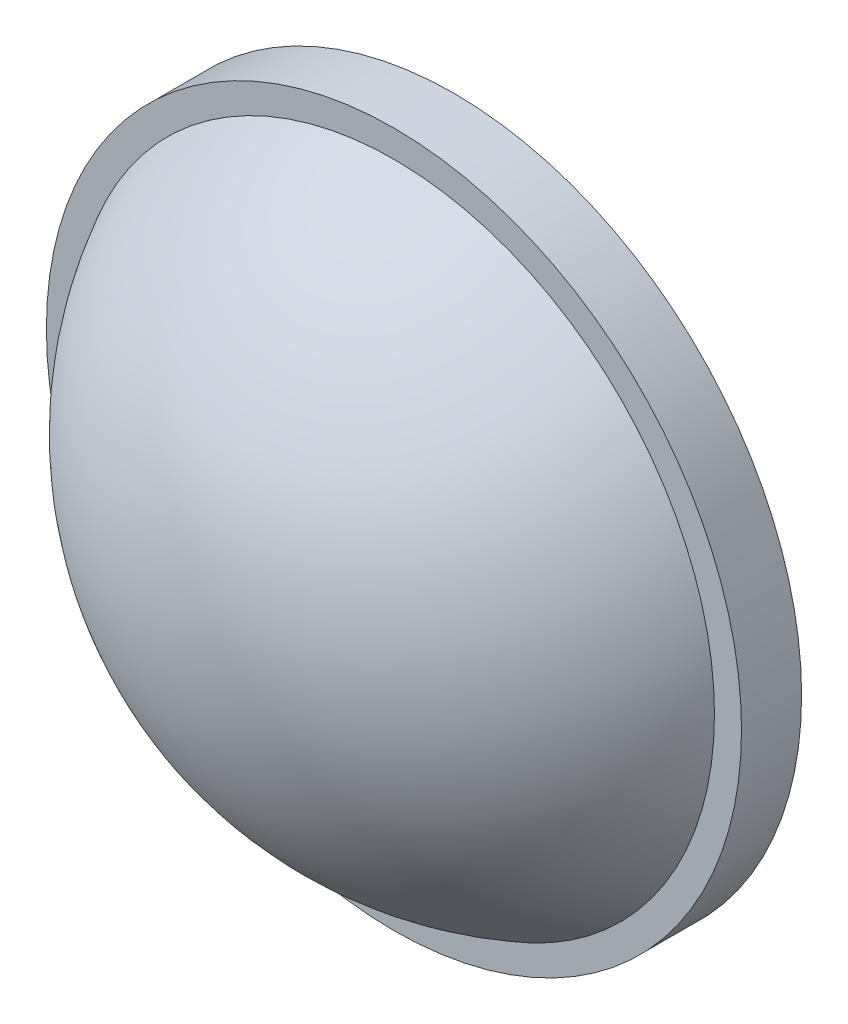
from build123d import *

# Parameters (mm, degrees)
SKETCH_1_R      = 17.35
EXTRUDE_1_DEPTH = 3


# Read off the part's stored shape, not the designer's step: 圓頂1
with BuildPart() as part:
    # 草圖1 → 填料-伸長1 (new body)
    with BuildSketch(Plane.XY):
        Circle(SKETCH_1_R)
    extrude(amount=EXTRUDE_1_DEPTH)

    # 圓頂1 outline → 圓頂1 (revolve)
    with BuildSketch(Plane.XZ):
        with BuildLine():
            Line((0, 3), (16.000000008, 2.999999984))
            ThreePointArc((16.000000008, 2.999999984), (9.368330969, 10.120466188), (0, 12.75))
            Line((0, 12.75), (0, 3))
        make_face()
    revolve(axis=Axis((0, 0, 0), (0, 0, 1)))


solid = part.part
